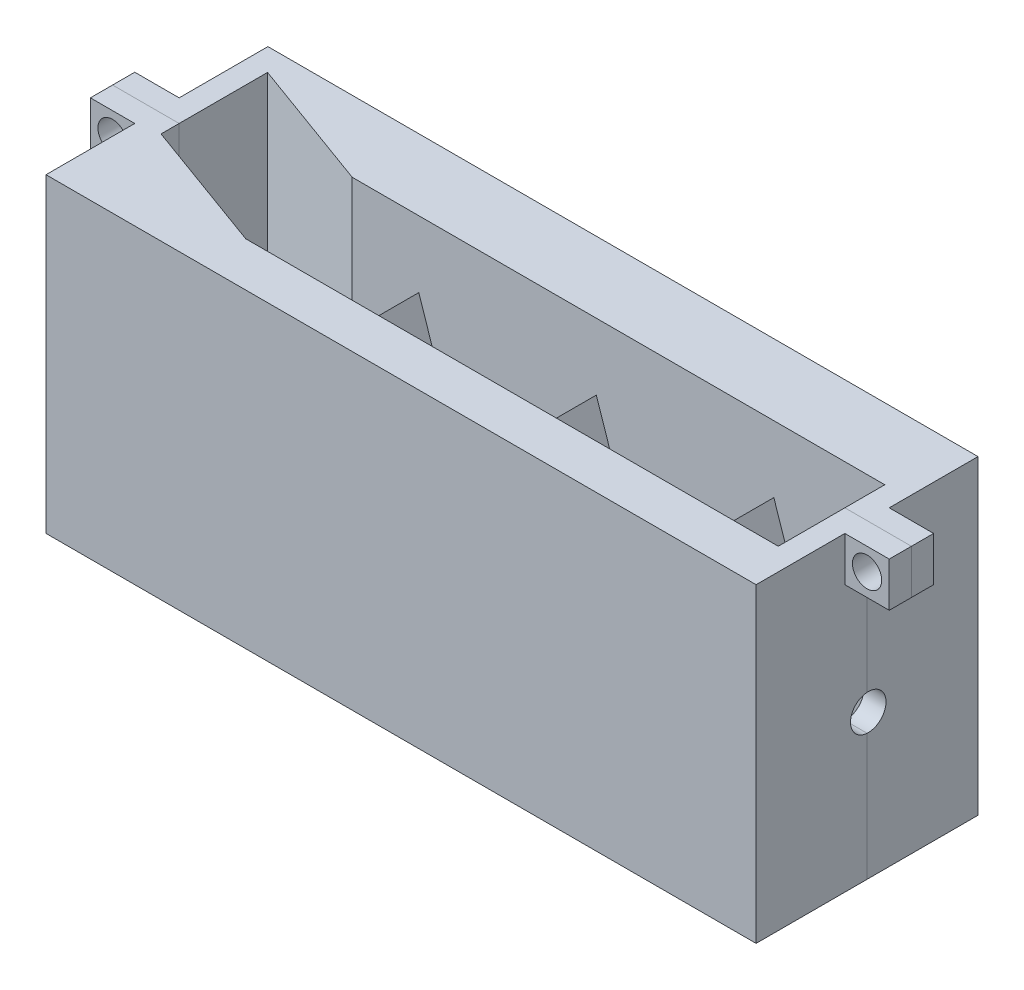
from build123d import *

# Parameters (mm, degrees)
SKETCH1_W           = 80
SKETCH1_H           = 25
BOSS_EXTRUDE1_DEPTH = 35
CAVITY1_START       = -22.459553514
CAVITY1_DEPTH       = 17.459553514
CAVITY1_START_2     = -17
CAVITY1_2_OUTLINE_W = 5
CAVITY1_2_OUTLINE_H = 5
CAVITY1_2_DEPTH     = 14
CAVITY1_START_3     = 17.5
CAVITY1_3_OUTLINE_W = 30
CAVITY1_3_OUTLINE_H = 5.459553514
CAVITY1_3_DEPTH     = 60
CAVITY1_START_4     = 5
CAVITY1_4_DEPTH     = 30
SKETCH2_W           = 5
SKETCH2_H           = 5
BOSS_EXTRUDE2_DEPTH = 5
SKETCH3_R           = 1.65
CUT_EXTRUDE1_DEPTH  = 5
CUT_EXTRUDE2_REACH  = 97.263
SKETCH4_R           = 2


with BuildPart() as part:
    # Sketch1 → Boss-Extrude1 (new body)
    with BuildSketch(Plane(origin=(0, 0, 0), x_dir=(1, 0, 0), z_dir=(0, 1, 0))):
        with Locations((40, 12.5)):
            Rectangle(SKETCH1_W, SKETCH1_H)
    extrude(amount=BOSS_EXTRUDE1_DEPTH)

    # Cavity1: read off the stored shape, not the designer's step
    # Cavity1 outline → Cavity1 (cut)
    with BuildSketch(Plane.XY.offset(CAVITY1_START)):
        Polygon((2.5, 5), (17.5, 5), (25, 27.5), (32.5, 5), (37.5, 5), (45, 27.5), (52.5, 5), (57.5, 5), (65, 27.5), (72.5, 5), (77.5, 5), (77.5, 30), (72.5, 30), (72.5, 35), (57.5, 35), (57.5, 30), (52.5, 30), (52.5, 35), (37.5, 35), (37.5, 30), (32.5, 30), (32.5, 35), (2.5, 35), align=None)
    extrude(amount=CAVITY1_DEPTH, mode=Mode.SUBTRACT)

    # Cavity1 2 outline → Cavity1 2 (cut)
    with BuildSketch(Plane.XY.offset(CAVITY1_START_2)):
        with Locations((35, 32.5)):
            Rectangle(CAVITY1_2_OUTLINE_W, CAVITY1_2_OUTLINE_H)
        with Locations((55, 32.5)):
            Rectangle(CAVITY1_2_OUTLINE_W, CAVITY1_2_OUTLINE_H)
        with Locations((75, 32.5)):
            Rectangle(CAVITY1_2_OUTLINE_W, CAVITY1_2_OUTLINE_H)
    extrude(amount=CAVITY1_2_DEPTH, mode=Mode.SUBTRACT)

    # Cavity1 3 outline → Cavity1 3 (add)
    with BuildSketch(Plane.YZ.offset(CAVITY1_START_3)):
        Polygon((35, -5), (35, -3), (30, -3), align=None)
        with Locations((20, -19.729776757)):
            Rectangle(CAVITY1_3_OUTLINE_W, CAVITY1_3_OUTLINE_H)
    extrude(amount=CAVITY1_3_DEPTH)

    # Cavity1 4 outline → Cavity1 4 (add)
    with BuildSketch(Plane(origin=(0, 0, 0), x_dir=(1, 0, 0), z_dir=(0, 1, 0)).offset(CAVITY1_START_4)):
        Polygon((17.5, 5), (2.5, 10.459553514), (2.5, 5), align=None)
        Polygon((17.5, 22.459553514), (2.5, 22.459553514), (17.5, 17), align=None)
    extrude(amount=CAVITY1_4_DEPTH)

    # Sketch2 → Boss-Extrude2 (add)
    with BuildSketch(Plane.ZY):
        with Locations((-12.5, 32.5)):
            Rectangle(SKETCH2_W, SKETCH2_H)
    boss_extrude2 = extrude(amount=BOSS_EXTRUDE2_DEPTH)

    # Sketch3 → Cut-Extrude1 (cut)
    with BuildSketch(Plane.XY.offset(-10)):
        with Locations((-2.5, 32.5)):
            Circle(SKETCH3_R)
    cut_extrude1 = extrude(amount=-CUT_EXTRUDE1_DEPTH, mode=Mode.SUBTRACT)

    # Mirror1: Boss-Extrude2, Cut-Extrude1 across plane
    add(boss_extrude2.mirror(Plane.ZY.offset(-40)))
    add(cut_extrude1.mirror(Plane.ZY.offset(-40)), mode=Mode.SUBTRACT)

    # Cut-Extrude2: up to this face of the body (flat: up to its plane)
    cut_extrude2_end = Plane(part.part.faces().sort_by_distance((80, 17.058823529, -12.5))[0])
    # Sketch4 → Cut-Extrude2 (cut, up to the picked face)
    with BuildSketch(Plane.ZY, mode=Mode.PRIVATE) as cut_extrude2_sk1:
        with Locations(Location((-12.636718447, 16.25, 0), (0, 0, 90))):
            Circle(SKETCH4_R)
    cut_extrude2_tool1 = split(extrude(cut_extrude2_sk1.sketch, amount=-CUT_EXTRUDE2_REACH, mode=Mode.PRIVATE), bisect_by=cut_extrude2_end, keep=Keep.BOTH, mode=Mode.PRIVATE)
    add(cut_extrude2_tool1.solids().sort_by(Axis((0, 16.25, -12.636718), (1, 0, 0)))[0], mode=Mode.SUBTRACT)


with BuildPart() as body_2:
    # Split1: the piece on the far side of the plane
    add(part.part)
    split(bisect_by=Plane(origin=(0, 0, -12.5), x_dir=(-1, 0, 0), z_dir=(0, 0, -1)), keep=Keep.BOTTOM)


with BuildPart() as part_1:
    add(part.part)

    # Split1
    split(bisect_by=Plane(origin=(0, 0, -12.5), x_dir=(-1, 0, 0), z_dir=(0, 0, -1)), keep=Keep.TOP)


solid = Compound([body_2.part, part_1.part])
